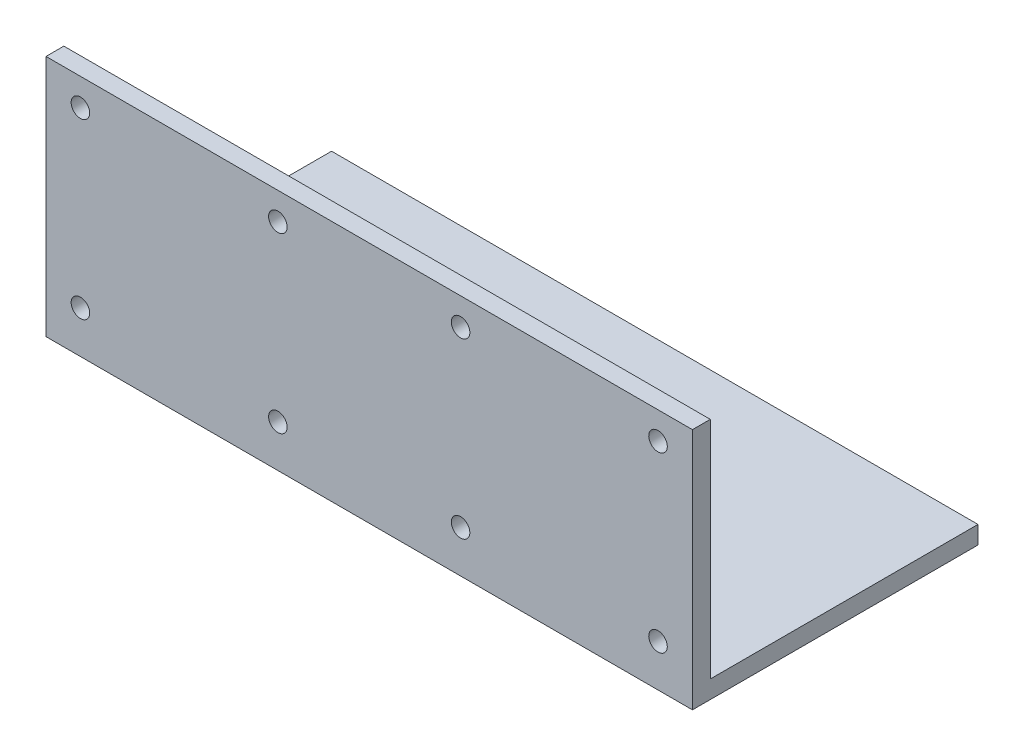
from build123d import *

# Parameters (mm, degrees)
BOSS_EXTRUDE1_DEPTH = 115
SKETCH2_R           = 3.3
CUT_EXTRUDE1_DEPTH  = 171.92584101


with BuildPart() as part:
    # Sketch1 → Boss-Extrude1 (new, symmetric)
    with BuildSketch(Plane(origin=(0, 0, 0), x_dir=(0, 0, -1), z_dir=(1, 0, 0))):
        Polygon((-50.8, -3.175), (50.8, -3.175), (50.8, 3.175), (-44.45, 3.175), (-44.45, 83.175), (-50.8, 83.175), (-50.8, 3.175), align=None)
    extrude(amount=BOSS_EXTRUDE1_DEPTH, both=True)

    # Sketch2 → Cut-Extrude1 (cut, through all)
    with BuildSketch(Plane(origin=(0, 0, 44.45), x_dir=(-1, 0, 0), z_dir=(0, 0, -1))):
        with Locations((-32.5, 73.491666667)):
            Circle(SKETCH2_R)
        with Locations((-32.5, 11.825)):
            Circle(SKETCH2_R)
        with Locations((32.5, 11.825)):
            Circle(SKETCH2_R)
        with Locations((32.5, 73.491666667)):
            Circle(SKETCH2_R)
        with Locations((-102.75, 73.491666667)):
            Circle(SKETCH2_R)
        with Locations((-102.75, 11.825)):
            Circle(SKETCH2_R)
        with Locations((102.75, 73.491666667)):
            Circle(SKETCH2_R)
        with Locations((102.75, 11.825)):
            Circle(SKETCH2_R)
    extrude(amount=-CUT_EXTRUDE1_DEPTH, mode=Mode.SUBTRACT)


solid = part.part
